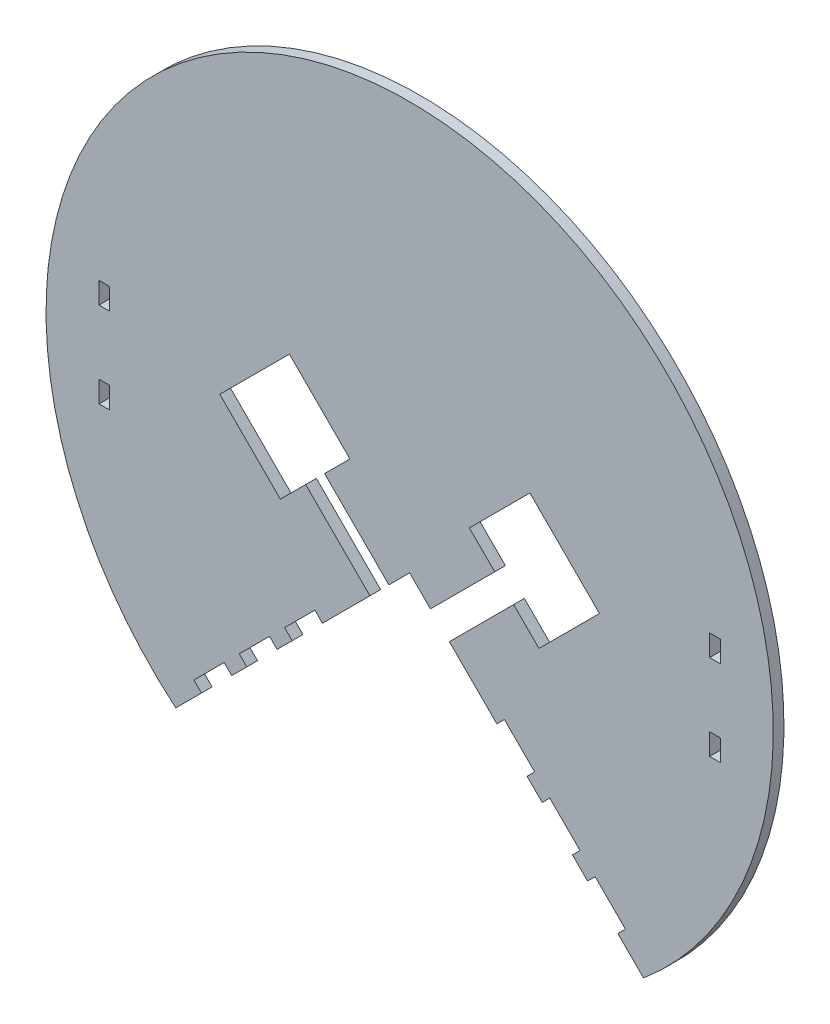
from build123d import *

# Parameters (mm, degrees)
SKETCH1_R           = 215.9
BOSS_EXTRUDE1_DEPTH = 6.35
CUT_EXTRUDE1_DEPTH  = 306.394732273
CUT_EXTRUDE2_DEPTH  = 306.394732273
SKETCH4_W           = 6.35
SKETCH4_H           = 12.7
CUT_EXTRUDE3_DEPTH  = 306.394732273
CUT_EXTRUDE4_DEPTH  = 6.35
LPATTERN1_COUNT     = 3
LPATTERN1_PITCH     = 38.1
CUT_EXTRUDE5_DEPTH  = 6.35
LPATTERN2_COUNT     = 3
LPATTERN2_PITCH     = 38.1


with BuildPart() as part:
    # Sketch1 → Boss-Extrude1 (new body)
    with BuildSketch(Plane.XY):
        Circle(SKETCH1_R)
    extrude(amount=BOSS_EXTRUDE1_DEPTH)

    # Sketch2 → Cut-Extrude1 (cut, through all)
    with BuildSketch(Plane(origin=(0, 0, 0), x_dir=(-1, 0, 0), z_dir=(0, 0, -1))):
        with BuildLine():
            Line((0, -26.441092948), (138.870288723, -165.311381671))
            ThreePointArc((138.870288723, -165.311381671), (0, -215.9), (-138.870288723, -165.311381671))
            Line((-138.870288723, -165.311381671), (0, -26.441092948))
        make_face()
    extrude(amount=-CUT_EXTRUDE1_DEPTH, mode=Mode.SUBTRACT)

    # Sketch3 → Cut-Extrude2 (cut, through all)
    with BuildSketch(Plane.XY.offset(6.35)):
        Polygon((71.393036162, 50.340096887), (35.472011678, 14.419072403), (50.513940681, -0.6228566), (12.347852166, -38.788945114), (23.573172318, -50.014265265), (61.739260832, -11.848176751), (76.781189835, -26.890105754), (112.702214319, 9.030918731), align=None)
    cut_extrude2 = extrude(amount=-CUT_EXTRUDE2_DEPTH, mode=Mode.SUBTRACT)

    # Mirror1: Cut-Extrude2 across plane
    add(cut_extrude2.mirror(Plane(origin=(0, 0, 0), x_dir=(0, 0, 1), z_dir=(1, 0, 0))), mode=Mode.SUBTRACT)

    # Sketch4 → Cut-Extrude3 (cut, through all)
    with BuildSketch(Plane.XY.offset(6.35)):
        with Locations((181.263437852, -25.4)):
            Rectangle(SKETCH4_W, SKETCH4_H)
        with Locations((181.263437852, 25.4)):
            Rectangle(SKETCH4_W, SKETCH4_H)
        with Locations((-181.263437852, 25.4)):
            Rectangle(SKETCH4_W, SKETCH4_H)
        with Locations((-181.263437852, -25.4)):
            Rectangle(SKETCH4_W, SKETCH4_H)
    extrude(amount=-CUT_EXTRUDE3_DEPTH, mode=Mode.SUBTRACT)

    # Sketch5 → Cut-Extrude4 (cut)
    with BuildSketch(Plane.XY.offset(6.35)):
        Polygon((-128.10574744, -145.566584266), (-110.145235198, -127.606072024), (-105.655107137, -132.096200085), (-123.615619379, -150.056712327), align=None)
    cut_extrude4 = extrude(amount=-CUT_EXTRUDE4_DEPTH, mode=Mode.SUBTRACT)

    # LPattern1: Cut-Extrude4 ×3
    with Locations(*[Vector(0.7071067811865477, 0.7071067811865475, 0) * (i * LPATTERN1_PITCH) for i in range(1, LPATTERN1_COUNT)]):
        add(cut_extrude4, mode=Mode.SUBTRACT)

    # Sketch6 → Cut-Extrude5 (cut)
    with BuildSketch(Plane.XY.offset(6.35)):
        Polygon((110.145235198, -127.606072024), (128.10574744, -145.566584266), (123.615619379, -150.056712327), (105.655107137, -132.096200085), align=None)
    cut_extrude5 = extrude(amount=-CUT_EXTRUDE5_DEPTH, mode=Mode.SUBTRACT)

    # LPattern2: Cut-Extrude5 ×3
    with Locations(*[Vector(-0.7071067811865489, 0.7071067811865461, 0) * (i * LPATTERN2_PITCH) for i in range(1, LPATTERN2_COUNT)]):
        add(cut_extrude5, mode=Mode.SUBTRACT)


solid = part.part
